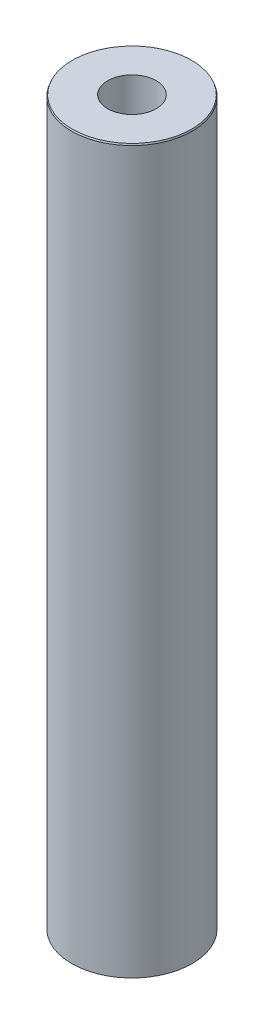
from build123d import *
from OCP.BRepFilletAPI import BRepFilletAPI_MakeChamfer

# Parameters (mm, degrees)
SKETCH1_R           = 50
BOSS_EXTRUDE1_DEPTH = 600
SKETCH2_R           = 20.154241403
CUT_EXTRUDE1_DEPTH  = 605.15229868
CHAMFER1_SIZE       = 1.243577833
CHAMFER1_SIZE2      = 0.485996405


with BuildPart() as part:
    # Sketch1 → Boss-Extrude1 (new body)
    with BuildSketch(Plane(origin=(0, 0, 0), x_dir=(1, 0, 0), z_dir=(0, 1, 0))):
        Circle(SKETCH1_R)
    extrude(amount=BOSS_EXTRUDE1_DEPTH)

    # Sketch2 → Cut-Extrude1 (cut, through all)
    with BuildSketch(Plane(origin=(0, 0, 0), x_dir=(1, 0, 0), z_dir=(0, 1, 0))):
        Circle(SKETCH2_R)
    extrude(amount=CUT_EXTRUDE1_DEPTH, mode=Mode.SUBTRACT)

    # Chamfer1: one chamfer whose edges measure the first distance from different faces: ONE call of the kernel's chamfer builder (chamfer() names one face for all edges)
    chamfer1_edges_1 = [part.edges().sort_by_distance(p)[0] for p in [
        (-50, 600, 0),
    ]]
    chamfer1_side_1 = [part.faces().sort_by_distance(p)[0] for p in [
        (-50, 300, 0),
    ]]
    chamfer1_edges_2 = [part.edges().sort_by_distance(p)[0] for p in [
        (-50, 0, 0),
    ]]
    chamfer1_side_2 = [part.faces().sort_by_distance(p)[0] for p in [
        (-48.585786438, 0, 0),
    ]]
    chamfer1 = BRepFilletAPI_MakeChamfer(part.part.solid().wrapped)
    for e in chamfer1_edges_1:
        chamfer1.Add(CHAMFER1_SIZE, CHAMFER1_SIZE2, e.wrapped, chamfer1_side_1[0].wrapped)  # the first distance lies on this face
    for e in chamfer1_edges_2:
        chamfer1.Add(CHAMFER1_SIZE, CHAMFER1_SIZE2, e.wrapped, chamfer1_side_2[0].wrapped)  # the first distance lies on this face
    add(Compound.cast(chamfer1.Shape()), mode=Mode.REPLACE)


solid = part.part
